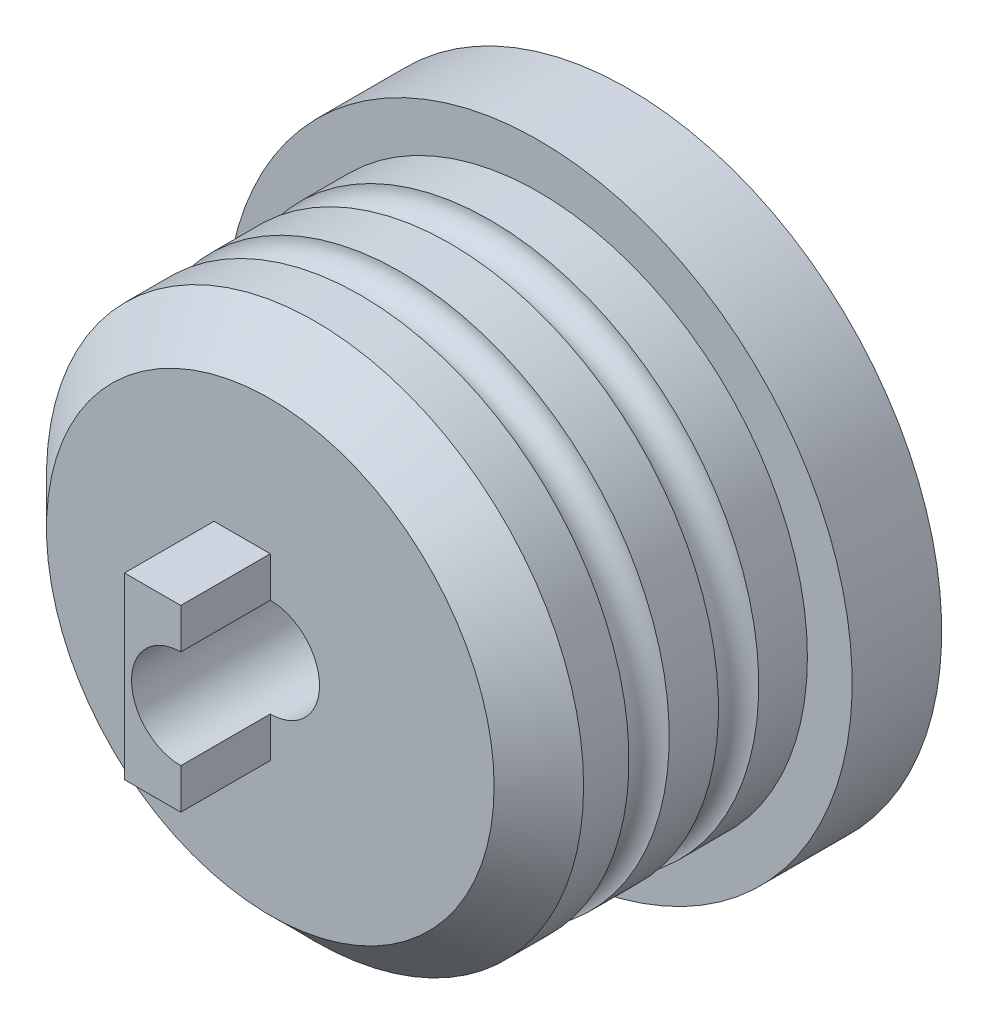
from build123d import *
from build123d.topology import SkipClean

# Parameters (mm, degrees)
ESQUISSE1_R                = 30
BOSS_EXTRU_1_DEPTH         = 30
ESQUISSE2_R                = 35
BOSS_EXTRU_2_DEPTH         = 10
CHANFREIN1_SIZE            = 5
ESQUISSE3_R                = 5.5
ENL_V_MAT_EXTRU_1_DEPTH    = 40
BOSS_EXTRU_6_DEPTH         = 10
ESQUISSE5_R                = 2.25
R_P_TITION_LIN_AIRE1_COUNT = 2
R_P_TITION_LIN_AIRE1_PITCH = 10


with BuildPart() as part:
    # Esquisse1 → Boss.-Extru.1 (new body)
    with BuildSketch(Plane.XY):
        Circle(ESQUISSE1_R)
    extrude(amount=BOSS_EXTRU_1_DEPTH)

    # Esquisse2 → Boss.-Extru.2 (add)
    with BuildSketch(Plane(origin=(0, 0, 0), x_dir=(-1, 0, 0), z_dir=(0, 0, -1))):
        Circle(ESQUISSE2_R)
    extrude(amount=BOSS_EXTRU_2_DEPTH)

    # Chanfrein1
    chanfrein1_edges = [part.edges().sort_by_distance(p)[0] for p in [
        (-30, 0, 30),
    ]]
    chamfer(chanfrein1_edges, length=CHANFREIN1_SIZE)

    # Esquisse3 → Enlèv. mat.-Extru.1 (cut)
    with BuildSketch(Plane(origin=(0, 0, -10), x_dir=(-1, 0, 0), z_dir=(0, 0, -1))):
        Circle(ESQUISSE3_R)
    extrude(amount=-ENL_V_MAT_EXTRU_1_DEPTH, mode=Mode.SUBTRACT)

    # Esquisse4 → Boss.-Extru.6 (add)
    with SkipClean():  # the faces are left unmerged after this step: merging them gives an invalid solid
        with BuildSketch(Plane.XY.offset(30)):
            with BuildLine():
                Line((0, 10), (0, 5.5))
                ThreePointArc((0, 5.5), (-5.5, 0), (0, -5.5))
                Line((0, -5.5), (0, -10))
                Line((0, -10), (-2.5, -10))
                Line((-2.5, -10), (-3.5, -10))
                Line((-3.5, -10), (-6.284490288, -10))
                Line((-6.284490288, -10), (-6.284490288, 10))
                Line((-6.284490288, 10), (-3.5, 10))
                Line((-3.5, 10), (-2.5, 10))
                Line((-2.5, 10), (0, 10))
            make_face()
        extrude(amount=BOSS_EXTRU_6_DEPTH)
    add(part.part.scale(1), mode=Mode.REPLACE)  # the faces are merged on a copy

    # Enlèvement de matière-Balayage1: sweep along a path in Esquisse6
    with BuildLine(Plane.XY.offset(8)) as enl_vement_de_mati_re_balayage1_path:
        CenterArc((0, 0), 23.00163751, 0, 360)
    # Esquisse5 → Enlèvement de matière-Balayage1 (sweep, cut)
    with BuildSketch(Plane(origin=(0, 0, 0), x_dir=(0, 0, -1), z_dir=(1, 0, 0))):
        with Locations((-7.687500001, -30)):
            Circle(ESQUISSE5_R)
    enl_vement_de_mati_re_balayage1 = sweep(path=enl_vement_de_mati_re_balayage1_path.line, mode=Mode.SUBTRACT)

    # Répétition linéaire1: Enlèvement de matière-Balayage1 ×2
    with Locations(*[(0, 0, i * R_P_TITION_LIN_AIRE1_PITCH) for i in range(1, R_P_TITION_LIN_AIRE1_COUNT)]):
        add(enl_vement_de_mati_re_balayage1, mode=Mode.SUBTRACT)


solid = part.part
